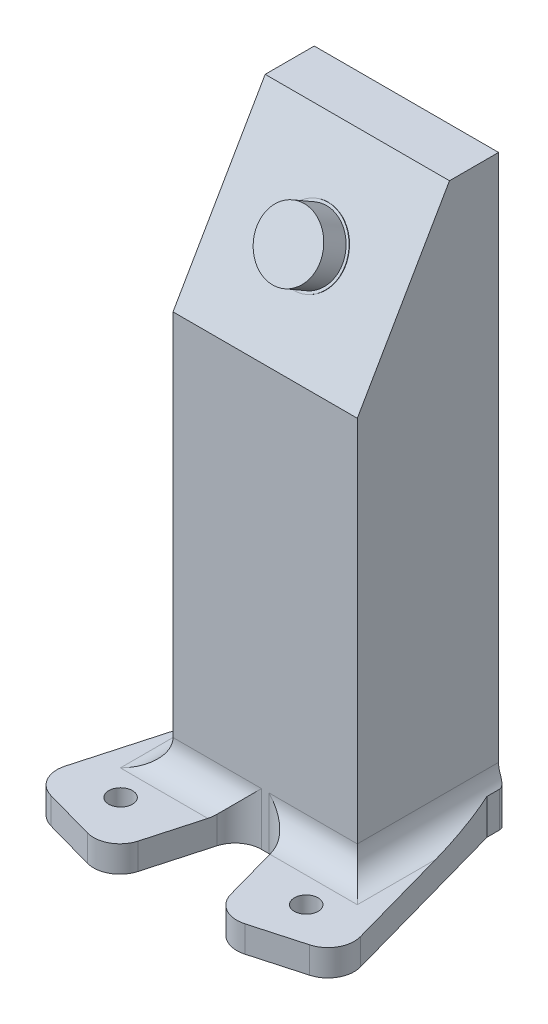
from build123d import *

# Parameters (mm, degrees)
AUFSATZ_LINEAR_AUSTRAGEN1_DEPTH = 35
SKIZZE3_R                       = 6
AUFSATZ_LINEAR_AUSTRAGEN2_DEPTH = 5
SKIZZE4_R                       = 6.5
AUFSATZ_LINEAR_AUSTRAGEN3_DEPTH = 0.1
SKIZZE9_R                       = 1.425
SCHNITT_LINEAR_AUSTRAGEN2_DEPTH = 10
SKIZZE10_R                      = 2.25
AUFSATZ_LINEAR_AUSTRAGEN4_DEPTH = 5
VERRUNDUNG1_R                   = 5
VERRUNDUNG2_R                   = 1


with BuildPart() as part:
    # Skizze1 → Aufsatz-Linear austragen1 (new body)
    with BuildSketch(Plane(origin=(0, 0, 0), x_dir=(0, 0, -1), z_dir=(1, 0, 0))):
        Polygon((0, 0), (17.5, 0), (26.82, 0), (26.82, 110.310889132), (17.5, 110.310889132), (0, 80), align=None)
    extrude(amount=AUFSATZ_LINEAR_AUSTRAGEN1_DEPTH)

    # Skizze3 → Aufsatz-Linear austragen2 (add)
    with BuildSketch(Plane(origin=(0, 20, 34.641016151), x_dir=(1, 0, 0), z_dir=(0, 0.4999999999999977, 0.86602540378444))):
        with Locations((17.5, 86.782032303)):
            Circle(SKIZZE3_R)
    extrude(amount=AUFSATZ_LINEAR_AUSTRAGEN2_DEPTH)

    # Skizze4 → Aufsatz-Linear austragen3 (add)
    with BuildSketch(Plane(origin=(0, 20, 34.641016151), x_dir=(1, 0, 0), z_dir=(0, 0.4999999999999977, 0.8660254037844399))):
        with Locations((17.5, 86.782032303)):
            Circle(SKIZZE4_R)
    extrude(amount=AUFSATZ_LINEAR_AUSTRAGEN3_DEPTH)

    # Skizze9 → Schnitt-Linear austragen2 (cut)
    with BuildSketch(Plane.XZ):
        with Locations((17.498844944, -21.644236877)):
            Circle(SKIZZE9_R)
    extrude(amount=-SCHNITT_LINEAR_AUSTRAGEN2_DEPTH, mode=Mode.SUBTRACT)

    # Skizze10 → Aufsatz-Linear austragen4 (add)
    # profile 1 of 2: a face of its own
    with BuildSketch(Plane.XZ):
        Polygon((35, -26.82), (36.222689888, -26.82), (36.222689888, -23.396698607), (46.889907729, 14.777378017), (27.627810102, 20.159904842), (21.994403466, 0), align=None)
        with Locations((35.124354886, 9.830031101)):
            Circle(SKIZZE10_R, mode=Mode.SUBTRACT)
    # profile 2 of 2: a face of its own
    with BuildSketch(Plane.XZ):
        Polygon((-1.222689888, -26.82), (-1.222689888, -23.396698607), (-11.889907729, 14.777378017), (7.372189898, 20.159904842), (13.005596534, 0), (0, -26.82), align=None)
        with Locations((-0.124354886, 9.830031101)):
            Circle(SKIZZE10_R, mode=Mode.SUBTRACT)
    extrude(amount=-AUFSATZ_LINEAR_AUSTRAGEN4_DEPTH)

    # Verrundung1
    verrundung1_edges = [part.edges().sort_by_distance(p)[0] for p in [
        (6.502798267, 5, 0),
        (28.497201733, 5, 0),
        (35, 5, -13.41),
        (0, 5, -13.41),
        (-11.889907729, 2.5, 14.777378017),
        (7.372189898, 2.5, 20.159904842),
        (46.889907729, 2.5, 14.777378017),
        (27.627810102, 2.5, 20.159904842),
        (21.994403466, 2.5, 0),
        (13.005596534, 2.5, 0),
    ]]
    fillet(verrundung1_edges, radius=VERRUNDUNG1_R)

    # Verrundung2
    verrundung2_edges = [part.edges().sort_by_distance(p)[0] for p in [
        (-1.222689888, 3.362018901, -26.82),
        (36.222689888, 3.362018901, -26.82),
    ]]
    fillet(verrundung2_edges, radius=VERRUNDUNG2_R)


solid = part.part
